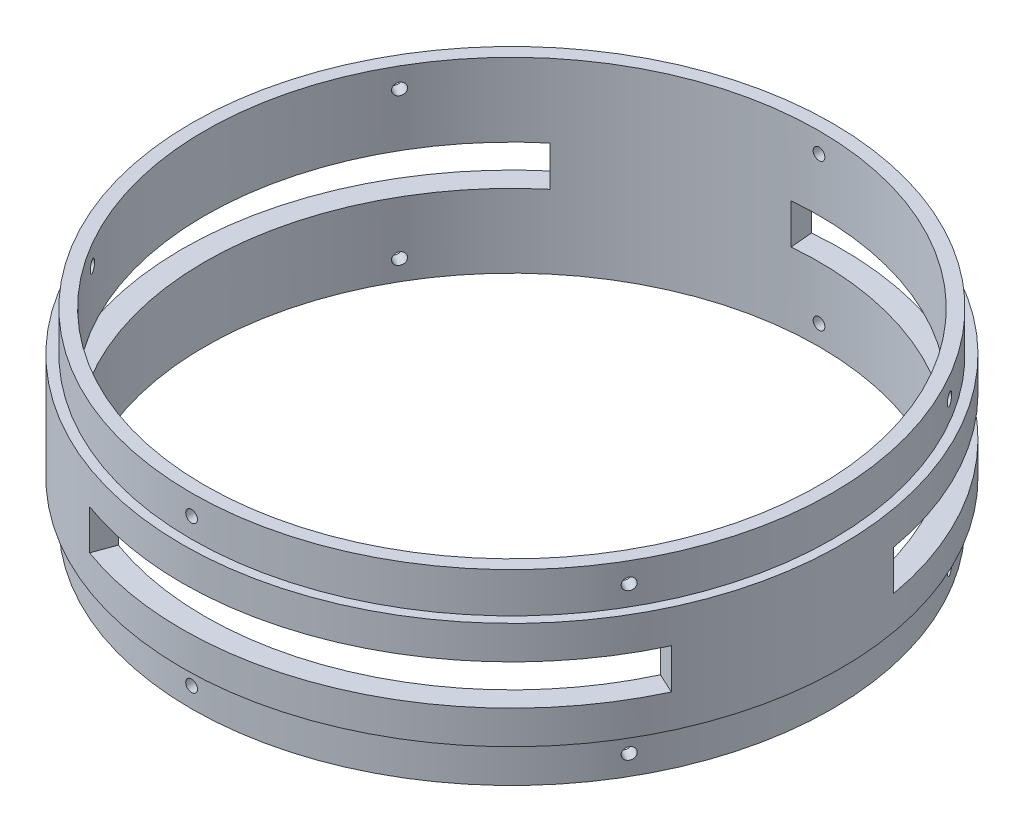
from build123d import *

# Parameters (mm, degrees)
SKETCH1_R               = 78.359
SKETCH1_R_2             = 73.025
BOSS_EXTRUDE1_DEPTH     = 25.4
BOSS_EXTRUDE2_START     = 25.4
SKETCH1_3_R             = 76.1746
SKETCH1_3_R_2           = 73.025
BOSS_EXTRUDE2_DEPTH     = 9.525
BOSS_EXTRUDE3_START     = -9.525
SKETCH1_4_R             = 76.1746
SKETCH1_4_R_2           = 73.025
BOSS_EXTRUDE3_DEPTH     = 9.525
CUT_EXTRUDE2_REACH      = 178.75
CUT_EXTRUDE2_END_RADIUS = 73.025
CUT_EXTRUDE3_START      = 7.9375
CUT_EXTRUDE3_DEPTH      = 9.525
CIRPATTERN2_COUNT       = 3
CIRPATTERN4_COUNT       = 3
CIRPATTERN3_COUNT       = 6


with BuildPart() as part:
    # Sketch1 → Boss-Extrude1 (new body)
    with BuildSketch(Plane(origin=(0, 0, 0), x_dir=(1, 0, 0), z_dir=(0, 1, 0))):
        with Locations(Location((0, 0, 0), (0, 0, 270))):
            Circle(SKETCH1_R)
        with Locations(Location((0, 0, 0), (0, 0, 270))):
            Circle(SKETCH1_R_2, mode=Mode.SUBTRACT)
    extrude(amount=BOSS_EXTRUDE1_DEPTH)

    # Sketch1<3> → Boss-Extrude2 (add)
    with BuildSketch(Plane(origin=(0, 0, 0), x_dir=(1, 0, 0), z_dir=(0, 1, 0)).offset(BOSS_EXTRUDE2_START)):
        with Locations(Location((0, 0, 0), (0, 0, 90))):
            Circle(SKETCH1_3_R)
        with Locations(Location((0, 0, 0), (0, 0, 270))):
            Circle(SKETCH1_3_R_2, mode=Mode.SUBTRACT)
    extrude(amount=BOSS_EXTRUDE2_DEPTH)

    # Sketch1<4> → Boss-Extrude3 (add)
    with BuildSketch(Plane(origin=(0, 0, 0), x_dir=(1, 0, 0), z_dir=(0, 1, 0)).offset(BOSS_EXTRUDE3_START)):
        with Locations(Location((0, 0, 0), (0, 0, 90))):
            Circle(SKETCH1_4_R)
        with Locations(Location((0, 0, 0), (0, 0, 270))):
            Circle(SKETCH1_4_R_2, mode=Mode.SUBTRACT)
    extrude(amount=BOSS_EXTRUDE3_DEPTH)

    # Cut-Extrude2: up to this cylinder (the profile starts outside it)
    cut_extrude2_end = Plane(origin=(0, 12.7, 0), z_dir=(0, -1, 0)) * Cylinder(CUT_EXTRUDE2_END_RADIUS, 539.475, mode=Mode.PRIVATE)
    # Sketch3 → Cut-Extrude2 (cut, up to the surface)
    with BuildSketch(Plane(origin=(0, 0, -76.1746), x_dir=(-1, 0, 0), z_dir=(0, 0, -1)), mode=Mode.PRIVATE) as cut_extrude2_sk1:
        with BuildLine():
            ThreePointArc((1.397, 30.1625), (0.987828173, 31.150328173), (0, 31.5595))
            Line((0, 31.5595), (0, 28.7655))
            ThreePointArc((0, 28.7655), (0.987828173, 29.174671827), (1.397, 30.1625))
        make_face()
    cut_extrude2_tool1 = extrude(cut_extrude2_sk1.sketch, amount=-CUT_EXTRUDE2_REACH, mode=Mode.PRIVATE) - cut_extrude2_end
    # Sketch3 → Cut-Extrude2 (cut, up to the surface)
    with BuildSketch(Plane(origin=(0, 0, -76.1746), x_dir=(-1, 0, 0), z_dir=(0, 0, -1)), mode=Mode.PRIVATE) as cut_extrude2_sk2:
        with BuildLine():
            Line((0, 28.7655), (0, 31.5595))
            ThreePointArc((0, 31.5595), (-1.397, 30.1625), (0, 28.7655))
        make_face()
    cut_extrude2_tool2 = extrude(cut_extrude2_sk2.sketch, amount=-CUT_EXTRUDE2_REACH, mode=Mode.PRIVATE) - cut_extrude2_end
    # Sketch3 → Cut-Extrude2 (cut, up to the surface)
    with BuildSketch(Plane(origin=(0, 0, -76.1746), x_dir=(-1, 0, 0), z_dir=(0, 0, -1)), mode=Mode.PRIVATE) as cut_extrude2_sk3:
        with BuildLine():
            ThreePointArc((1.397, 30.1625), (0.987828173, 31.150328173), (0, 31.5595))
            Line((0, 31.5595), (0, 28.7655))
            ThreePointArc((0, 28.7655), (0.987828173, 29.174671827), (1.397, 30.1625))
        make_face()
    cut_extrude2_tool3 = extrude(cut_extrude2_sk3.sketch, amount=-CUT_EXTRUDE2_REACH, mode=Mode.PRIVATE) - cut_extrude2_end
    # Sketch3 → Cut-Extrude2 (cut, up to the surface)
    with BuildSketch(Plane(origin=(0, 0, -76.1746), x_dir=(-1, 0, 0), z_dir=(0, 0, -1)), mode=Mode.PRIVATE) as cut_extrude2_sk4:
        with BuildLine():
            Line((0, 28.7655), (0, 31.5595))
            ThreePointArc((0, 31.5595), (-1.397, 30.1625), (0, 28.7655))
        make_face()
    cut_extrude2_tool4 = extrude(cut_extrude2_sk4.sketch, amount=-CUT_EXTRUDE2_REACH, mode=Mode.PRIVATE) - cut_extrude2_end
    # Sketch3 → Cut-Extrude2 (cut, up to the surface)
    with BuildSketch(Plane(origin=(0, 0, -76.1746), x_dir=(-1, 0, 0), z_dir=(0, 0, -1)), mode=Mode.PRIVATE) as cut_extrude2_sk5:
        with BuildLine():
            ThreePointArc((1.397, -4.7625), (0.987828173, -3.774671827), (0, -3.3655))
            Line((0, -3.3655), (0, -6.1595))
            ThreePointArc((0, -6.1595), (0.987828173, -5.750328173), (1.397, -4.7625))
        make_face()
    cut_extrude2_tool5 = extrude(cut_extrude2_sk5.sketch, amount=-CUT_EXTRUDE2_REACH, mode=Mode.PRIVATE) - cut_extrude2_end
    # Sketch3 → Cut-Extrude2 (cut, up to the surface)
    with BuildSketch(Plane(origin=(0, 0, -76.1746), x_dir=(-1, 0, 0), z_dir=(0, 0, -1)), mode=Mode.PRIVATE) as cut_extrude2_sk6:
        with BuildLine():
            Line((0, -6.1595), (0, -3.3655))
            ThreePointArc((0, -3.3655), (-1.397, -4.7625), (0, -6.1595))
        make_face()
    cut_extrude2_tool6 = extrude(cut_extrude2_sk6.sketch, amount=-CUT_EXTRUDE2_REACH, mode=Mode.PRIVATE) - cut_extrude2_end
    # Sketch3 → Cut-Extrude2 (cut, up to the surface)
    with BuildSketch(Plane(origin=(0, 0, -76.1746), x_dir=(-1, 0, 0), z_dir=(0, 0, -1)), mode=Mode.PRIVATE) as cut_extrude2_sk7:
        with BuildLine():
            ThreePointArc((1.397, -4.7625), (0.987828173, -3.774671827), (0, -3.3655))
            Line((0, -3.3655), (0, -6.1595))
            ThreePointArc((0, -6.1595), (0.987828173, -5.750328173), (1.397, -4.7625))
        make_face()
    cut_extrude2_tool7 = extrude(cut_extrude2_sk7.sketch, amount=-CUT_EXTRUDE2_REACH, mode=Mode.PRIVATE) - cut_extrude2_end
    # Sketch3 → Cut-Extrude2 (cut, up to the surface)
    with BuildSketch(Plane(origin=(0, 0, -76.1746), x_dir=(-1, 0, 0), z_dir=(0, 0, -1)), mode=Mode.PRIVATE) as cut_extrude2_sk8:
        with BuildLine():
            Line((0, -6.1595), (0, -3.3655))
            ThreePointArc((0, -3.3655), (-1.397, -4.7625), (0, -6.1595))
        make_face()
    cut_extrude2_tool8 = extrude(cut_extrude2_sk8.sketch, amount=-CUT_EXTRUDE2_REACH, mode=Mode.PRIVATE) - cut_extrude2_end
    cut_extrude2 = cut_extrude2_tool1.solids().sort_by_distance((-0.592905, 30.1625, -76.1746))[0] + cut_extrude2_tool2.solids().sort_by_distance((0.592905, 30.1625, -76.1746))[0] + cut_extrude2_tool3.solids().sort_by_distance((-0.592905, 30.1625, -76.1746))[0] + cut_extrude2_tool4.solids().sort_by_distance((0.592905, 30.1625, -76.1746))[0] + cut_extrude2_tool5.solids().sort_by_distance((-0.592905, -4.7625, -76.1746))[0] + cut_extrude2_tool6.solids().sort_by_distance((0.592905, -4.7625, -76.1746))[0] + cut_extrude2_tool7.solids().sort_by_distance((-0.592905, -4.7625, -76.1746))[0] + cut_extrude2_tool8.solids().sort_by_distance((0.592905, -4.7625, -76.1746))[0]
    add(cut_extrude2, mode=Mode.SUBTRACT)

    # Sketch1<7> → Cut-Extrude3 (cut)
    with BuildSketch(Plane(origin=(0, 0, 0), x_dir=(1, 0, 0), z_dir=(0, 1, 0)).offset(CUT_EXTRUDE3_START)):
        with BuildLine():
            ThreePointArc((-6.364548114, 72.747117828), (44.454803353, 57.934627675), (71.915586164, 12.680658174))
            Line((71.915586164, 12.680658174), (77.168550718, 13.606897554))
            ThreePointArc((77.168550718, 13.606897554), (47.701936816, 62.166374392), (-6.829436846, 78.060820348))
            Line((-6.829436846, 78.060820348), (-6.364548114, 72.747117828))
        make_face()
    cut_extrude3 = extrude(amount=CUT_EXTRUDE3_DEPTH, mode=Mode.SUBTRACT)

    # CirPattern2: Cut-Extrude3 ×3 about axis
    cirpattern2_axis = Axis((0, 0, 0), (0, 1, 0))
    for i in range(1, CIRPATTERN2_COUNT):
        add(cut_extrude3.rotate(cirpattern2_axis, i * 360 / CIRPATTERN2_COUNT), mode=Mode.SUBTRACT)

    # CirPattern4: Cut-Extrude2 ×3 about axis
    cirpattern4_axis = Axis((0, 0, 0), (0, 1, 0))
    for i in range(1, CIRPATTERN4_COUNT):
        add(cut_extrude2.rotate(cirpattern4_axis, i * 360 / CIRPATTERN4_COUNT), mode=Mode.SUBTRACT)

    # CirPattern3: Cut-Extrude2 ×6 about axis
    cirpattern3_axis = Axis((0, -9.513205862, 0), (0, 1, 0))
    for i in range(1, CIRPATTERN3_COUNT):
        add(cut_extrude2.rotate(cirpattern3_axis, i * 360 / CIRPATTERN3_COUNT), mode=Mode.SUBTRACT)


solid = part.part
